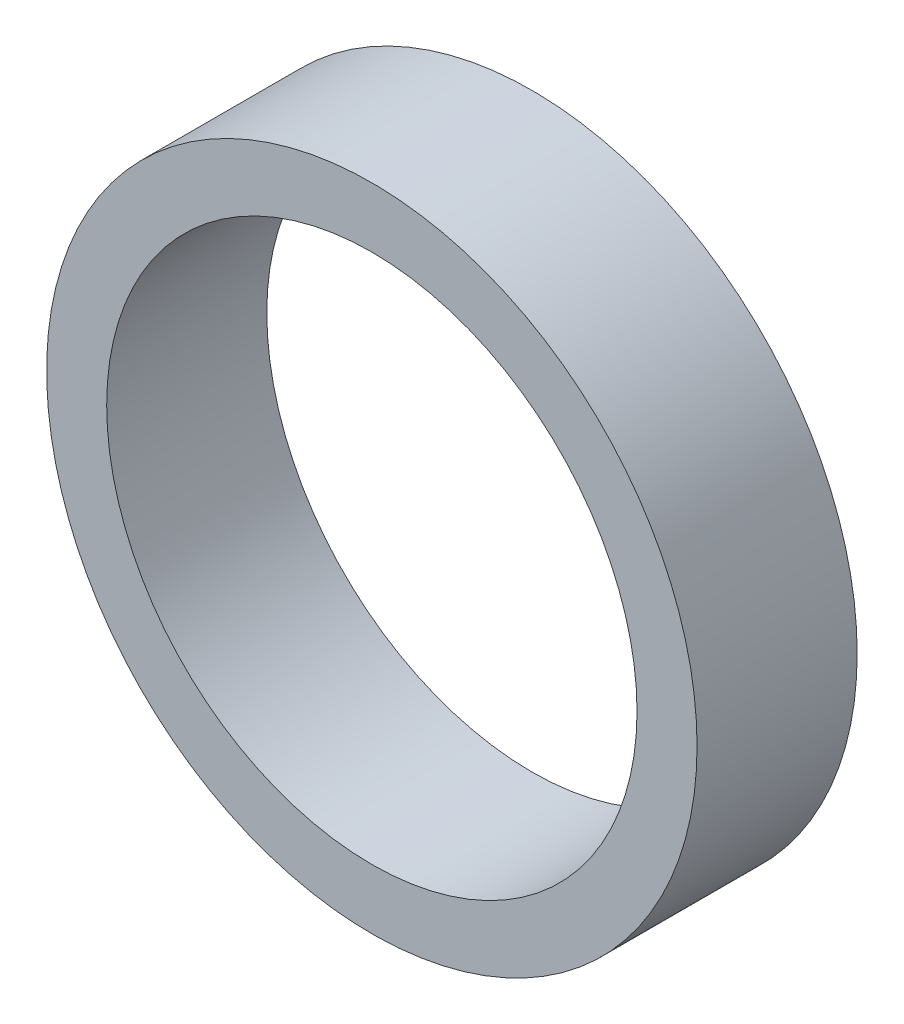
from build123d import *

# Parameters (mm, degrees)
SKETCH1_R           = 3.25
SKETCH1_R_2         = 2.65
BOSS_EXTRUDE1_DEPTH = 1.6


with BuildPart() as part:
    # Sketch1 → Boss-Extrude1 (new body)
    with BuildSketch(Plane.XY):
        Circle(SKETCH1_R)
        Circle(SKETCH1_R_2, mode=Mode.SUBTRACT)
    extrude(amount=BOSS_EXTRUDE1_DEPTH)


solid = part.part
